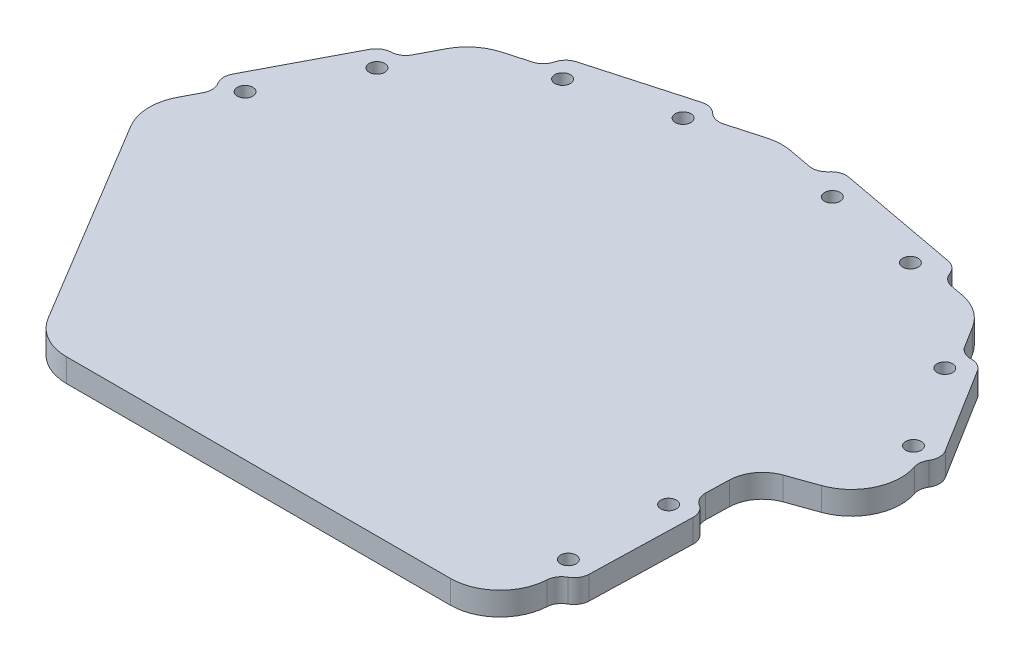
from build123d import *

# Parameters (mm, degrees)
SKETCH1_R           = 1.27
BOSS_EXTRUDE1_DEPTH = 3.81
FILLET1_R           = 8.128
FILLET2_R           = 5.588
FILLET3_R           = 2.54
FILLET4_R           = 2.54


with BuildPart() as part:
    # Sketch1 → Boss-Extrude1 (new body)
    with BuildSketch(Plane(origin=(0, 0, 0), x_dir=(1, 0, 0), z_dir=(0, 1, 0))):
        Polygon((26.917778839, 57.028322157), (18.764761653, 58.551267753), (19.231154767, 61.048081215), (-4.411826254, 65.464479834), (-4.878219367, 62.967666372), (-13.031236553, 64.490611968), (-22.811913306, 61.740346117), (-23.499479769, 64.185515305), (-43.060833275, 58.684983602), (-42.373266812, 56.239814414), (-52.153943565, 53.489548563), (-56.864625449, 44.487600096), (-59.115112565, 45.665270567), (-68.536476333, 27.661373635), (-66.285989216, 26.483703164), (-70.9966711, 17.481754697), (-45.779512683, -24.409388032), (29.596058622, -24.409388032), (29.864982666, -14.252947718), (32.404982666, -14.320202292), (32.942830753, 5.992678337), (30.402830753, 6.059932911), (30.671754796, 16.216373225), (48.398722953, 22.529356376), (43.028486925, 31.154097821), (45.184672286, 32.496656828), (34.444200229, 49.746139719), (32.288014868, 48.403580712), align=None)
        with Locations(Location((28.652499761, -12.063891898, 0), (0, 0, 90))):
            Circle(SKETCH1_R, mode=Mode.SUBTRACT)
        with Locations(Location((29.076203579, 3.938108102, 0), (0, 0, 90))):
            Circle(SKETCH1_R, mode=Mode.SUBTRACT)
        with Locations(Location((-64.159725757, 27.807781977, 0), (0, 0, 90))):
            Circle(SKETCH1_R, mode=Mode.SUBTRACT)
        with Locations(Location((-56.740401791, 41.985850812, 0), (0, 0, 90))):
            Circle(SKETCH1_R, mode=Mode.SUBTRACT)
        with Locations(Location((-39.951089771, 55.601661313, 0), (0, 0, 90))):
            Circle(SKETCH1_R, mode=Mode.SUBTRACT)
        with Locations(Location((-24.546523885, 59.933330029, 0), (0, 0, 90))):
            Circle(SKETCH1_R, mode=Mode.SUBTRACT)
        with Locations(Location((40.809219088, 32.315575875, 0), (0, 0, 90))):
            Circle(SKETCH1_R, mode=Mode.SUBTRACT)
        with Locations(Location((-1.154887819, 60.980198638, 0), (0, 0, 90))):
            Circle(SKETCH1_R, mode=Mode.SUBTRACT)
        with Locations(Location((14.575036992, 58.041922025, 0), (0, 0, 90))):
            Circle(SKETCH1_R, mode=Mode.SUBTRACT)
        with Locations(Location((32.351097343, 45.899543651, 0), (0, 0, 90))):
            Circle(SKETCH1_R, mode=Mode.SUBTRACT)
    extrude(amount=BOSS_EXTRUDE1_DEPTH)

    # Fillet1
    fillet1_edges = [part.edges().sort_by_distance(p)[0] for p in [
        (29.596058622, 1.905, 24.409388032),
        (-45.779512683, 1.905, 24.409388032),
        (-70.9966711, 1.905, -17.481754697),
        (-52.153943565, 1.905, -53.489548563),
        (-13.031236553, 1.905, -64.490611968),
        (26.917778839, 1.905, -57.028322157),
        (48.398722953, 1.905, -22.529356376),
    ]]
    fillet(fillet1_edges, radius=FILLET1_R)

    # Fillet2
    fillet2_edges = [part.edges().sort_by_distance(p)[0] for p in [
        (30.671754796, 1.905, -16.216373225),
    ]]
    fillet(fillet2_edges, radius=FILLET2_R)

    # Fillet3
    # the kernel refuses this fillet: 2.54 mm, written as the material it adds along each edge
    with BuildSketch(Plane(origin=(43.028486925, 0, -31.154097821), x_dir=(0.42954622715766955, 0, 0.9030448708312405), z_dir=(0, 1, 0))) as fillet3_piece_1:
        with BuildLine():
            CenterArc((2.27034081, 2.521441091), FILLET3_R, 186.469886636, 76.599657859)
            Line((-0.253482478, 2.235231353), (-0.505864807, 2.206610379))
            Line((-0.505864807, 2.206610379), (-0.252382329, -0.028620974))
            Line((-0.252382329, -0.028620974), (0.028620974, -0.252382329))
            ThreePointArc((0.028620974, -0.252382329), (0.095841513, -0.244759302), (1.933204138, -0.252144109))
            Line((1.933204138, -0.252144109), (1.963852927, 0))
        make_face()
    extrude(amount=3.81)
    with BuildSketch(Plane(origin=(29.864982666, 0, 14.252947718), x_dir=(0.9996496372388306, 0, 0.02646890190911047), z_dir=(0, 1, 0))) as fillet3_piece_2:
        with BuildLine():
            CenterArc((2.535902872, -2.54), FILLET3_R, 90, 88.412002671)
            Line((-0.003121621, -2.469610926), (-0.25702407, -2.462572019))
            ThreePointArc((-0.25702407, -2.462572019), (-0.254, -2.244365891), (-0.254, 0))
            Line((-0.254, 0), (0, 0.254))
            Line((0, 0.254), (2.535902872, 0.254))
            Line((2.535902872, 0.254), (2.535902872, 0))
        make_face()
    extrude(amount=3.81)
    with BuildSketch(Plane(origin=(30.402830753, 0, -6.059932911), x_dir=(0.026468901909109464, 0, -0.9996496372388307), z_dir=(0, 1, 0)), Plane(origin=(-66.285989216, 0, -26.483703164), x_dir=(-0.4636497916963805, 0, 0.8860185498396199), z_dir=(0, 1, 0)), Plane(origin=(-56.864625449, 0, -44.487600096), x_dir=(-0.8860185498396245, 0, -0.46364979169637166), z_dir=(0, 1, 0))) as fillet3_piece_3:
        with BuildLine():
            CenterArc((FILLET3_R, -FILLET3_R), FILLET3_R, 90, 90)
            Line((0, -FILLET3_R), (0, 0))
            Line((0, 0), (FILLET3_R, 0))
        make_face()
    extrude(amount=3.81)
    with BuildSketch(Plane(origin=(-42.373266812, 0, -56.239814414), x_dir=(-0.27069545780340803, 0, -0.9626650347470834), z_dir=(0, 1, 0)), Plane(origin=(-22.811913306, 0, -61.740346117), x_dir=(0.9626650347470831, 0, -0.27069545780340953), z_dir=(0, 1, 0)), Plane(origin=(-4.878219367, 0, -62.967666372), x_dir=(0.18361933590472898, 0, -0.9829974259792882), z_dir=(0, 1, 0)), Plane(origin=(18.764761653, 0, -58.551267753), x_dir=(0.9829974259792874, 0, 0.18361933590473364), z_dir=(0, 1, 0)), Plane(origin=(32.288014868, 0, -48.403580712), x_dir=(0.848891874527916, 0, -0.5285665382527359), z_dir=(0, 1, 0))) as fillet3_piece_4:
        with BuildLine():
            CenterArc((FILLET3_R, FILLET3_R), FILLET3_R, 180, 90)
            Line((0, FILLET3_R), (0, 0))
            Line((0, 0), (FILLET3_R, 0))
        make_face()
    extrude(amount=3.81)

    # Fillet4
    fillet4_edges = [part.edges().sort_by_distance(p)[0] for p in [
        (32.404982666, 1.905, 14.320202292),
        (32.942830753, 1.905, -5.992678337),
        (45.184672286, 1.905, -32.496656828),
        (34.444200229, 1.905, -49.746139719),
        (19.231154767, 1.905, -61.048081215),
        (-4.411826254, 1.905, -65.464479834),
        (-23.499479769, 1.905, -64.185515305),
        (-43.060833275, 1.905, -58.684983602),
        (-59.115112565, 1.905, -45.665270567),
        (-68.536476333, 1.905, -27.661373635),
    ]]
    fillet(fillet4_edges, radius=FILLET4_R)


solid = part.part
